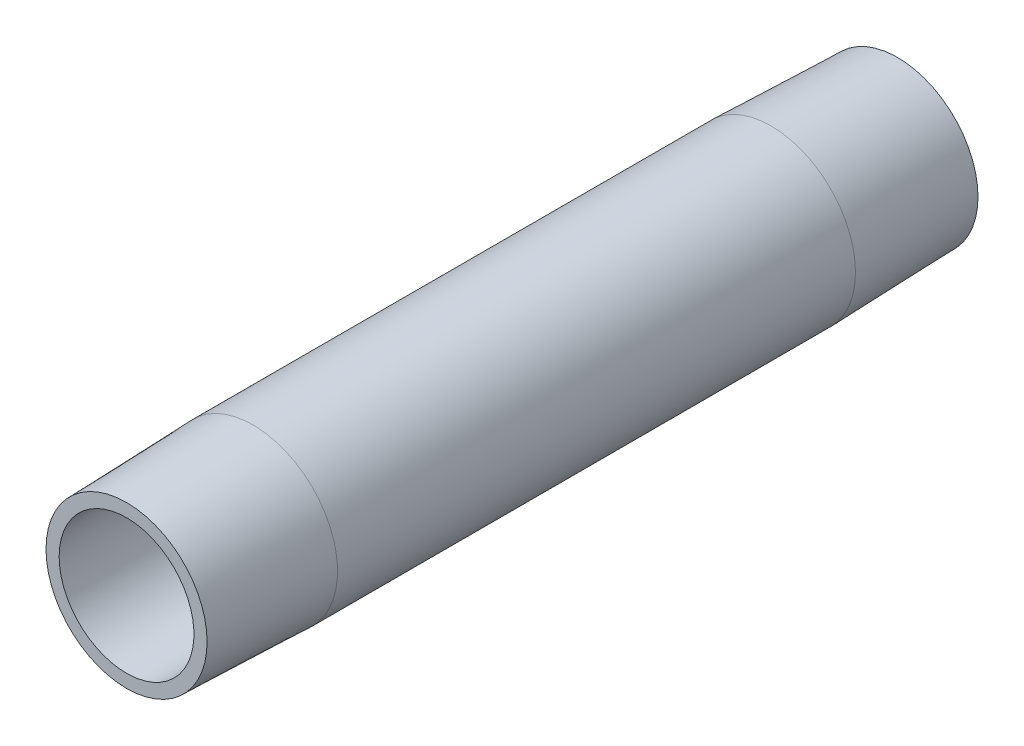
from build123d import *

# Parameters (mm, degrees)
PIPESKETCH_R    = 16.7005
PIPESKETCH_R_2  = 13.3223
EXTRUSION_DEPTH = 152.4


with BuildPart() as part:
    # PipeSketch → Extrusion (new body)
    with BuildSketch(Plane.XY):
        Circle(PIPESKETCH_R)
        Circle(PIPESKETCH_R_2, mode=Mode.SUBTRACT)
    extrude(amount=EXTRUSION_DEPTH)

    # ThdSketch → Thread (revolve, cut)
    with BuildSketch(Plane(origin=(0, 0, 0), x_dir=(0, 0, -1), z_dir=(1, 0, 0))):
        Polygon((-127.3937, 16.7005), (-152.4, 15.921926519), (-152.4, 16.7005), align=None)
        Polygon((0, 16.7005), (-25.0063, 16.7005), (0, 15.921926519), align=None)
    revolve(axis=Axis((0, 0, 152.4), (0, 0, -1)), mode=Mode.SUBTRACT)


solid = part.part
